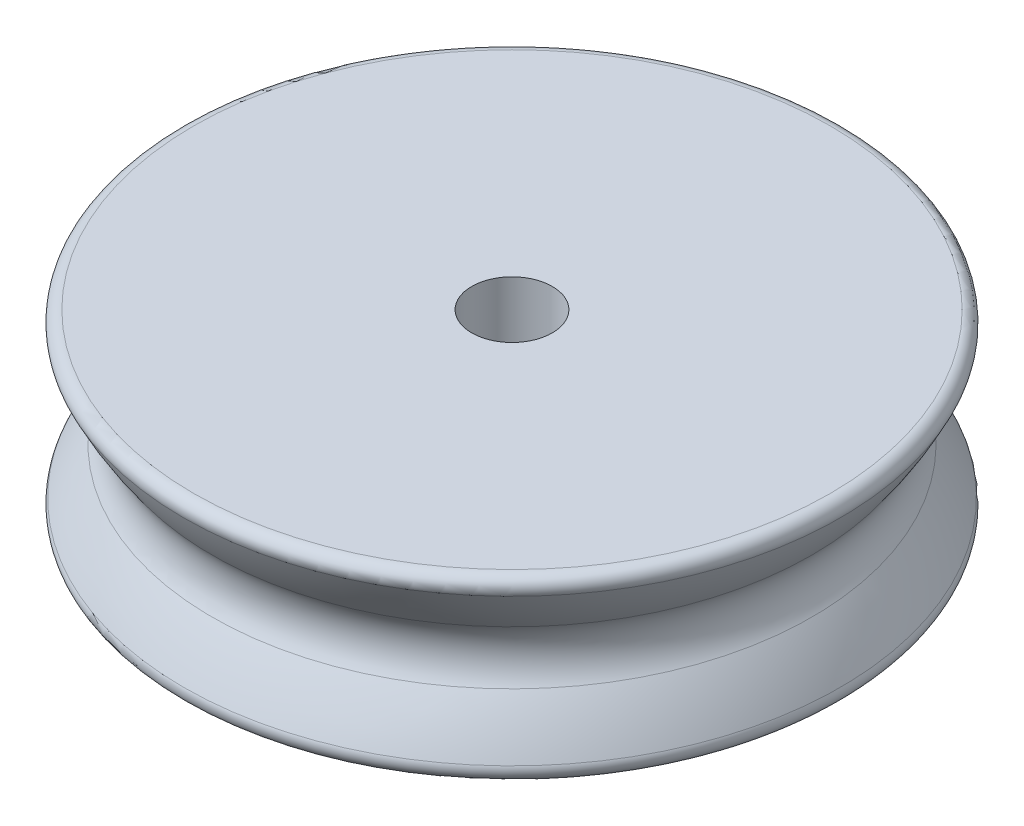
from build123d import *

# Parameters (mm, degrees)
FILLET1_R = 16.51
FILLET2_R = 0.635


with BuildPart() as part:
    # Sketch1 → Revolve1 (revolve)
    with BuildSketch(Plane.XY, mode=Mode.PRIVATE) as revolve1_sk:
        with BuildLine():
            Line((2.286, 5.08), (2.286, -5.08))
            Line((2.286, -5.08), (19.05, -5.08))
            Line((19.05, -5.08), (19.05, -2.54))
            ThreePointArc((19.05, -2.54), (16.51, 0), (19.05, 2.54))
            Line((19.05, 2.54), (19.05, 5.08))
            Line((19.05, 5.08), (2.286, 5.08))
        make_face()
    revolve(revolve1_sk.sketch.rotate(Axis((0, 5.08, 0), (0, -1, 0)), 90), axis=Axis((0, 5.08, 0), (0, -1, 0)))

    # Fillet1
    # the kernel refuses this fillet: 16.51 mm, written as the material it takes off along each edge
    with BuildSketch(Plane(origin=(0, 2.54, 0), x_dir=(0, 0, 1), z_dir=(1, 0, 0))) as fillet1_piece_1:
        with BuildLine():
            CenterArc((3.81, -8.89), FILLET1_R, 22.619864948, 14.250032698)
            Line((19.05, -2.54), (19.3548, -2.413))
            ThreePointArc((19.3548, -2.413), (19.3802, -1.27), (19.3802, 0))
            Line((19.3802, 0), (19.05, 0.3302))
            ThreePointArc((19.05, 0.3302), (18.061747397, 0.563494793), (17.28216, 1.21412))
            Line((17.28216, 1.21412), (17.018, 1.016))
        make_face()
    revolve(axis=Axis((0, 2.54, 0), (0, -1, 0)), mode=Mode.SUBTRACT)
    with BuildSketch(Plane(origin=(0, -2.54, 0), x_dir=(0, 0, 1), z_dir=(1, 0, 0))) as fillet1_piece_2:
        with BuildLine():
            CenterArc((3.81, 8.89), FILLET1_R, 323.130102354, 14.250032698)
            Line((17.018, -1.016), (17.28216, -1.21412))
            ThreePointArc((17.28216, -1.21412), (18.061747397, -0.563494793), (19.05, -0.3302))
            Line((19.05, -0.3302), (19.3802, 0))
            ThreePointArc((19.3802, 0), (19.3802, 1.27), (19.3548, 2.413))
            Line((19.3548, 2.413), (19.05, 2.54))
        make_face()
    revolve(axis=Axis((0, -2.54, 0), (0, -1, 0)), mode=Mode.SUBTRACT)

    # Fillet2
    fillet2_edges = [part.edges().sort_by_distance(p)[0] for p in [
        (0, 5.08, -19.05),
        (0, -5.08, -19.05),
    ]]
    fillet(fillet2_edges, radius=FILLET2_R)


solid = part.part
